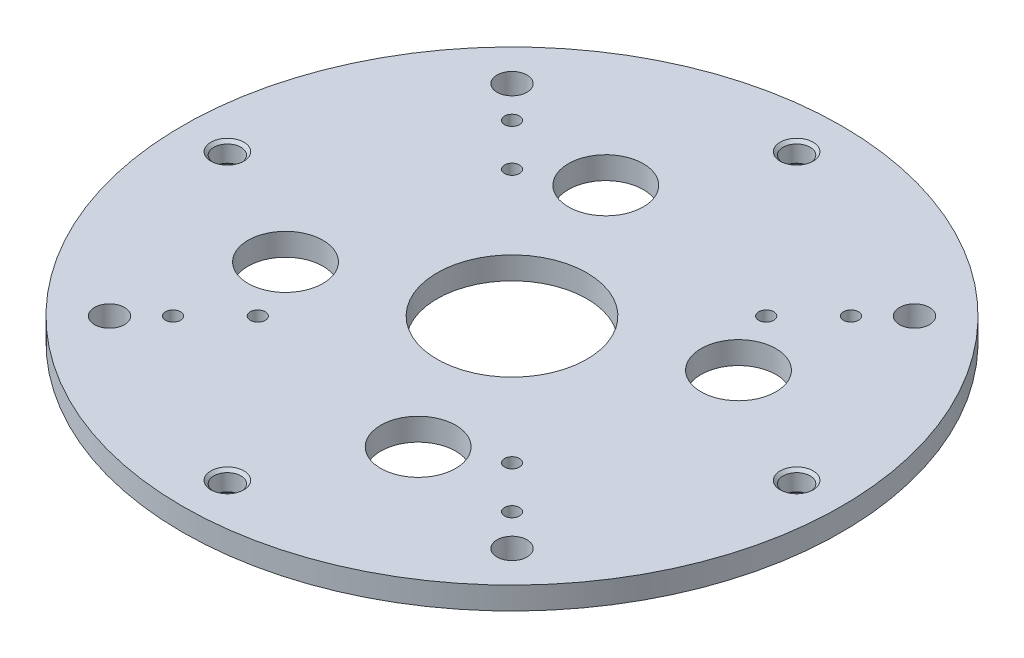
from build123d import *

# Parameters (mm, degrees)
SKETCH2_R                        = 139.7
SKETCH2_R_2                      = 31.75
BOSS_EXTRUDE1_DEPTH              = 9.525
SKETCH3_R                        = 3.175
SKETCH3_R_2                      = 6.35
CUT_EXTRUDE2_DEPTH               = 198.795110215
F_1_2_20_TAPPED_HOLE1_AT_2_COUNT = 2
F_1_2_20_TAPPED_HOLE1_AT_2_PITCH = 170.6248663
F_1_2_20_TAPPED_HOLE1_AT_3_COUNT = 2
F_1_2_20_TAPPED_HOLE1_AT_3_PITCH = 241.3
F_1_2_20_TAPPED_HOLE1_AT_4_COUNT = 2
F_1_2_20_TAPPED_HOLE1_AT_4_PITCH = 170.6248663
DELETE_CUTOUTS_DEPTH             = 9.525
SKETCH13_R                       = 15.875
CUT_EXTRUDE7_DEPTH               = 198.795110215
CIRPATTERN1_COUNT                = 4


# Read off the part's stored shape, not the designer's step: delete_cutouts
with BuildPart() as part:
    # Sketch2 → Boss-Extrude1 (new body)
    with BuildSketch(Plane(origin=(0, 0, 0), x_dir=(1, 0, 0), z_dir=(0, 1, 0))):
        with Locations(Location((0, 0, 0), (0, 0, 90))):
            Circle(SKETCH2_R)
        with Locations(Location((0, 0, 0), (0, 0, 90))):
            Circle(SKETCH2_R_2, mode=Mode.SUBTRACT)
        with BuildLine():
            Line((61.954602754, 26.03357827), (81.460512242, 45.539487758))
            ThreePointArc((81.460512242, 45.539487758), (87.024437868, 47.307910551), (91.68068299, 43.785983677))
            ThreePointArc((91.68068299, 43.785983677), (101.6, 0), (91.68068299, -43.785983677))
            ThreePointArc((91.68068299, -43.785983677), (87.024437868, -47.307910551), (81.460512242, -45.539487758))
            Line((81.460512242, -45.539487758), (61.954602754, -26.03357827))
            ThreePointArc((61.954602754, -26.03357827), (60.270643836, -23.027751383), (60.404300741, -19.584954736))
            ThreePointArc((60.404300741, -19.584954736), (63.5, 0), (60.404300741, 19.584954736))
            ThreePointArc((60.404300741, 19.584954736), (60.270643836, 23.027751383), (61.954602754, 26.03357827))
        make_face(mode=Mode.SUBTRACT)
        with BuildLine():
            Line((26.03357827, 61.954602754), (45.539487758, 81.460512242))
            ThreePointArc((45.539487758, 81.460512242), (47.307910551, 87.024437868), (43.785983677, 91.68068299))
            ThreePointArc((43.785983677, 91.68068299), (0, 101.6), (-43.785983677, 91.68068299))
            ThreePointArc((-43.785983677, 91.68068299), (-47.307910551, 87.024437868), (-45.539487758, 81.460512242))
            Line((-45.539487758, 81.460512242), (-26.03357827, 61.954602754))
            ThreePointArc((-26.03357827, 61.954602754), (-23.027751383, 60.270643836), (-19.584954736, 60.404300741))
            ThreePointArc((-19.584954736, 60.404300741), (0, 63.5), (19.584954736, 60.404300741))
            ThreePointArc((19.584954736, 60.404300741), (23.027751383, 60.270643836), (26.03357827, 61.954602754))
        make_face(mode=Mode.SUBTRACT)
        with BuildLine():
            Line((26.03357827, -61.954602754), (45.539487758, -81.460512242))
            ThreePointArc((45.539487758, -81.460512242), (47.307910551, -87.024437868), (43.785983677, -91.68068299))
            ThreePointArc((43.785983677, -91.68068299), (0, -101.6), (-43.785983677, -91.68068299))
            ThreePointArc((-43.785983677, -91.68068299), (-47.307910551, -87.024437868), (-45.539487758, -81.460512242))
            Line((-45.539487758, -81.460512242), (-26.03357827, -61.954602754))
            ThreePointArc((-26.03357827, -61.954602754), (-23.027751383, -60.270643836), (-19.584954736, -60.404300741))
            ThreePointArc((-19.584954736, -60.404300741), (0, -63.5), (19.584954736, -60.404300741))
            ThreePointArc((19.584954736, -60.404300741), (23.027751383, -60.270643836), (26.03357827, -61.954602754))
        make_face(mode=Mode.SUBTRACT)
        with BuildLine():
            Line((-61.954602754, -26.03357827), (-81.460512242, -45.539487758))
            ThreePointArc((-81.460512242, -45.539487758), (-87.024437868, -47.307910551), (-91.68068299, -43.785983677))
            ThreePointArc((-91.68068299, -43.785983677), (-101.6, 0), (-91.68068299, 43.785983677))
            ThreePointArc((-91.68068299, 43.785983677), (-87.024437868, 47.307910551), (-81.460512242, 45.539487758))
            Line((-81.460512242, 45.539487758), (-61.954602754, 26.03357827))
            ThreePointArc((-61.954602754, 26.03357827), (-60.270643836, 23.027751383), (-60.404300741, 19.584954736))
            ThreePointArc((-60.404300741, 19.584954736), (-63.5, 0), (-60.404300741, -19.584954736))
            ThreePointArc((-60.404300741, -19.584954736), (-60.270643836, -23.027751383), (-61.954602754, -26.03357827))
        make_face(mode=Mode.SUBTRACT)
    extrude(amount=BOSS_EXTRUDE1_DEPTH)

    # Sketch3 → Cut-Extrude2 (cut, through all)
    with BuildSketch(Plane(origin=(0, 9.525, 0), x_dir=(1, 0, 0), z_dir=(0, 1, 0))):
        with Locations(Location((-71.842048969, 71.842048969, 0), (0, 0, 270))):
            Circle(SKETCH3_R)
        with Locations(Location((-53.881536726, 53.881536726, 0), (0, 0, 270))):
            Circle(SKETCH3_R)
        with Locations(Location((-71.842048969, -71.842048969, 0), (0, 0, 270))):
            Circle(SKETCH3_R)
        with Locations(Location((71.842048969, -71.842048969, 0), (0, 0, 270))):
            Circle(SKETCH3_R)
        with Locations(Location((71.842048969, 71.842048969, 0), (0, 0, 270))):
            Circle(SKETCH3_R)
        with Locations(Location((53.881536726, 53.881536726, 0), (0, 0, 270))):
            Circle(SKETCH3_R)
        with Locations(Location((53.881536726, -53.881536726, 0), (0, 0, 270))):
            Circle(SKETCH3_R)
        with Locations(Location((-53.881536726, -53.881536726, 0), (0, 0, 270))):
            Circle(SKETCH3_R)
        with Locations(Location((85.31243315, 85.31243315, 0), (0, 0, 270))):
            Circle(SKETCH3_R_2)
        with Locations(Location((85.31243315, -85.31243315, 0), (0, 0, 270))):
            Circle(SKETCH3_R_2)
        with Locations(Location((-85.31243315, -85.31243315, 0), (0, 0, 270))):
            Circle(SKETCH3_R_2)
        with Locations(Location((-85.31243315, 85.31243315, 0), (0, 0, 270))):
            Circle(SKETCH3_R_2)
    extrude(amount=-CUT_EXTRUDE2_DEPTH, mode=Mode.SUBTRACT)

    # Sketch7 → 1/2-20 Tapped Hole1 (revolve, cut)
    with BuildSketch(Plane(origin=(-120.65, 9.525, 0), x_dir=(0, 0, 1), z_dir=(1, 0, 0))):
        Polygon((0, 0), (0, 9.525), (6.985, 9.525), (5.75437, 8.29437), (5.75437, 1.23063), (6.985, 0), align=None)
    f_1_2_20_tapped_hole1 = revolve(axis=Axis((-120.65, 15.875, 0), (0, -1, 0)), mode=Mode.SUBTRACT)

    # 1/2-20 Tapped Hole1 at 2: 1/2-20 Tapped Hole1 ×2
    with Locations(*[Vector(0.7071067811865476, 0, -0.7071067811865476) * (i * F_1_2_20_TAPPED_HOLE1_AT_2_PITCH) for i in range(1, F_1_2_20_TAPPED_HOLE1_AT_2_COUNT)]):
        add(f_1_2_20_tapped_hole1, mode=Mode.SUBTRACT)

    # 1/2-20 Tapped Hole1 at 3: 1/2-20 Tapped Hole1 ×2
    with Locations(*[(i * F_1_2_20_TAPPED_HOLE1_AT_3_PITCH, 0, 0) for i in range(1, F_1_2_20_TAPPED_HOLE1_AT_3_COUNT)]):
        add(f_1_2_20_tapped_hole1, mode=Mode.SUBTRACT)

    # 1/2-20 Tapped Hole1 at 4: 1/2-20 Tapped Hole1 ×2
    with Locations(*[Vector(0.7071067811865475, 0, 0.7071067811865477) * (i * F_1_2_20_TAPPED_HOLE1_AT_4_PITCH) for i in range(1, F_1_2_20_TAPPED_HOLE1_AT_4_COUNT)]):
        add(f_1_2_20_tapped_hole1, mode=Mode.SUBTRACT)

    # delete_cutouts outline → delete_cutouts (add)
    with BuildSketch(Plane(origin=(0, 0, 0), x_dir=(1, 0, 0), z_dir=(0, 1, 0))):
        with BuildLine():
            ThreePointArc((-81.460512242, 45.539487758), (-87.024437868, 47.307910551), (-91.68068299, 43.785983677))
            ThreePointArc((-91.68068299, 43.785983677), (-101.6, 0), (-91.68068299, -43.785983677))
            ThreePointArc((-91.68068299, -43.785983677), (-87.024437868, -47.307910551), (-81.460512242, -45.539487758))
            Line((-81.460512242, -45.539487758), (-61.954602754, -26.03357827))
            ThreePointArc((-61.954602754, -26.03357827), (-60.270643836, -23.027751382), (-60.404300741, -19.584954736))
            ThreePointArc((-60.404300741, -19.584954736), (-63.5, 0), (-60.404300741, 19.584954736))
            ThreePointArc((-60.404300741, 19.584954736), (-60.270643836, 23.027751382), (-61.954602754, 26.03357827))
            Line((-61.954602754, 26.03357827), (-81.460512242, 45.539487758))
        make_face()
        with BuildLine():
            ThreePointArc((-43.785983677, -91.68068299), (0, -101.6), (43.785983677, -91.68068299))
            ThreePointArc((43.785983677, -91.68068299), (47.307910551, -87.024437868), (45.539487758, -81.460512242))
            Line((45.539487758, -81.460512242), (26.03357827, -61.954602754))
            ThreePointArc((26.03357827, -61.954602754), (23.027751382, -60.270643836), (19.584954736, -60.404300741))
            ThreePointArc((19.584954736, -60.404300741), (0, -63.5), (-19.584954736, -60.404300741))
            ThreePointArc((-19.584954736, -60.404300741), (-23.027751382, -60.270643836), (-26.03357827, -61.954602754))
            Line((-26.03357827, -61.954602754), (-45.539487758, -81.460512242))
            ThreePointArc((-45.539487758, -81.460512242), (-47.307910551, -87.024437868), (-43.785983677, -91.68068299))
        make_face()
        with BuildLine():
            ThreePointArc((91.68068299, -43.785983677), (101.6, 0), (91.68068299, 43.785983677))
            ThreePointArc((91.68068299, 43.785983677), (87.024437868, 47.307910551), (81.460512242, 45.539487758))
            Line((81.460512242, 45.539487758), (61.954602754, 26.03357827))
            ThreePointArc((61.954602754, 26.03357827), (60.270643836, 23.027751382), (60.404300741, 19.584954736))
            ThreePointArc((60.404300741, 19.584954736), (63.5, 0), (60.404300741, -19.584954736))
            ThreePointArc((60.404300741, -19.584954736), (60.270643836, -23.027751382), (61.954602754, -26.03357827))
            Line((61.954602754, -26.03357827), (81.460512242, -45.539487758))
            ThreePointArc((81.460512242, -45.539487758), (87.024437868, -47.307910551), (91.68068299, -43.785983677))
        make_face()
        with BuildLine():
            ThreePointArc((43.785983677, 91.68068299), (0, 101.6), (-43.785983677, 91.68068299))
            ThreePointArc((-43.785983677, 91.68068299), (-47.307910551, 87.024437868), (-45.539487758, 81.460512242))
            Line((-45.539487758, 81.460512242), (-26.03357827, 61.954602754))
            ThreePointArc((-26.03357827, 61.954602754), (-23.027751382, 60.270643836), (-19.584954736, 60.404300741))
            ThreePointArc((-19.584954736, 60.404300741), (0, 63.5), (19.584954736, 60.404300741))
            ThreePointArc((19.584954736, 60.404300741), (23.027751382, 60.270643836), (26.03357827, 61.954602754))
            Line((26.03357827, 61.954602754), (45.539487758, 81.460512242))
            ThreePointArc((45.539487758, 81.460512242), (47.307910551, 87.024437868), (43.785983677, 91.68068299))
        make_face()
    extrude(amount=DELETE_CUTOUTS_DEPTH)

    # Sketch13 → Cut-Extrude7 (cut, through all)
    with BuildSketch(Plane.XZ):
        with Locations(Location((67.890050919, -28.120979841, 0), (0, 0, 270))):
            Circle(SKETCH13_R)
    cut_extrude7 = extrude(amount=-CUT_EXTRUDE7_DEPTH, mode=Mode.SUBTRACT)

    # CirPattern1: Cut-Extrude7 ×4 about axis
    cirpattern1_axis = Axis((0, 0, 0), (0, 1, 0))
    for i in range(1, CIRPATTERN1_COUNT):
        add(cut_extrude7.rotate(cirpattern1_axis, i * 360 / CIRPATTERN1_COUNT), mode=Mode.SUBTRACT)


solid = part.part
